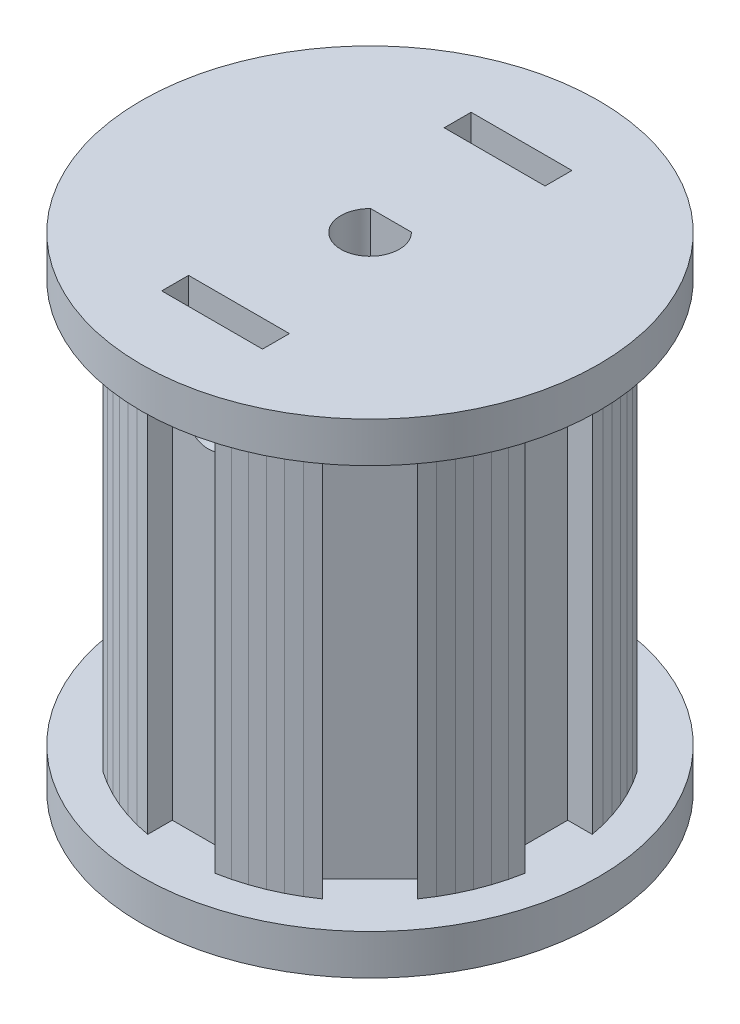
from build123d import *

# Parameters (mm, degrees)
SKETCH1_R           = 17
BOSS_EXTRUDE1_DEPTH = 3
SKETCH3_R           = 17
BOSS_EXTRUDE2_DEPTH = 3
BOSS_EXTRUDE3_DEPTH = 31
SKETCH7_R           = 1.751351815
CUT_EXTRUDE11_DEPTH = 50
CUT_EXTRUDE1_DEPTH  = 50
SKETCH8_W           = 7.5
SKETCH8_H           = 2
CUT_EXTRUDE12_DEPTH = 40


with BuildPart() as part:
    # Sketch1 → Boss-Extrude1 (new body)
    with BuildSketch(Plane(origin=(0, -15, 0), x_dir=(1, 0, 0), z_dir=(0, 1, 0))):
        Circle(SKETCH1_R)
    extrude(amount=BOSS_EXTRUDE1_DEPTH)



with BuildPart() as body_2:
    # Sketch3 → Boss-Extrude2 (new body)
    with BuildSketch(Plane(origin=(0, 21, 0), x_dir=(1, 0, 0), z_dir=(0, 1, 0))):
        Circle(SKETCH3_R)
    extrude(amount=-BOSS_EXTRUDE2_DEPTH)


with BuildPart() as part_1:
    add(part.part)

    add(body_2.part)  # Boss-Extrude3 merges body 2
    # Sketch6 → Boss-Extrude3 (add)
    with BuildSketch(Plane(origin=(0, -12, 0), x_dir=(1, 0, 0), z_dir=(0, 1, 0))):
        Polygon((-10.39609313, -6.860559341), (-11.68775931, -8.152225055), (-12.244775891, -7.288892753), (-12.738139369, -6.387668662), (-13.165283017, -5.453239195), (-13.523988426, -4.490460269), (-13.812389225, -3.504338907), (-14.028987847, -2.499999944), (-12.202296406, -2.499999944), (-12.202296406, 2.499999944), (-14.028987847, 2.499999944), (-13.812389225, 3.504338907), (-13.523988426, 4.490460269), (-13.165283017, 5.453239195), (-12.738139369, 6.387668662), (-12.244775891, 7.288892753), (-11.68775931, 8.152225055), (-10.39609313, 6.860559341), (-6.860559341, 10.39609313), (-8.152225055, 11.68775931), (-7.288892753, 12.244775891), (-6.387668662, 12.738139369), (-5.453239195, 13.165283017), (-4.490460269, 13.523988426), (-3.504338907, 13.812389225), (-2.499999944, 14.028987847), (-2.499999944, 12.174172863), (2.499999944, 12.202296406), (2.499999944, 14.028987847), (3.504338907, 13.812389225), (4.490460269, 13.523988426), (5.453239195, 13.165283017), (6.387668662, 12.738139369), (7.288892753, 12.244775891), (8.152225055, 11.68775931), (6.860559341, 10.39609313), (10.39609313, 6.860559341), (11.68775931, 8.152225055), (12.244775891, 7.288892753), (12.738139369, 6.387668662), (13.165283017, 5.453239195), (13.523988426, 4.490460269), (13.812389225, 3.504338907), (14.028987847, 2.499999944), (12.202296406, 2.499999944), (12.202296406, -2.499999944), (14.028987847, -2.499999944), (13.812389225, -3.504338907), (13.523988426, -4.490460269), (13.165283017, -5.453239195), (12.738139369, -6.387668662), (12.244775891, -7.288892753), (11.68775931, -8.152225055), (10.39609313, -6.860559341), (6.860559341, -10.39609313), (8.152225055, -11.68775931), (7.288892753, -12.244775891), (6.387668662, -12.738139369), (5.453239195, -13.165283017), (4.490460269, -13.523988426), (3.504338907, -13.812389225), (2.499999944, -14.028987847), (2.499999944, -12.202296406), (-2.499999944, -12.202296406), (-2.499999944, -14.028987847), (-3.504338907, -13.812389225), (-4.490460269, -13.523988426), (-5.453239195, -13.165283017), (-6.387668662, -12.738139369), (-7.288892753, -12.244775891), (-8.152225055, -11.68775931), (-6.860559341, -10.39609313), align=None)
    extrude(amount=BOSS_EXTRUDE3_DEPTH)

    # Sketch7 → Cut-Extrude11 (cut)
    with BuildSketch(Plane(origin=(-0.068553102, 0, -12.187849043), x_dir=(-0.9999841817006155, 0, 0.005624619858302935), z_dir=(-0.005624619858302935, 0, -0.9999841817006155))):
        with Locations((-0.120761258, 15)):
            Circle(SKETCH7_R)
    extrude(amount=-CUT_EXTRUDE11_DEPTH, mode=Mode.SUBTRACT)

    # Sketch2 → Cut-Extrude1 (cut)
    with BuildSketch(Plane(origin=(0, -15, 0), x_dir=(1, 0, 0), z_dir=(0, 1, 0))):
        with BuildLine():
            Line((1.514793699, 1.566442938), (-1.521232282, 1.566442938))
            ThreePointArc((-1.521232282, 1.566442938), (-0.003219291, -2.164389177), (1.514793699, 1.566442938))
        make_face()
    extrude(amount=CUT_EXTRUDE1_DEPTH, mode=Mode.SUBTRACT)

    # Sketch8 → Cut-Extrude12 (cut)
    with BuildSketch(Plane(origin=(0, -15, 0), x_dir=(1, 0, 0), z_dir=(0, 1, 0))):
        with Locations((-0.237061367, 10.505385433)):
            Rectangle(SKETCH8_W, SKETCH8_H)
    cut_extrude12 = extrude(amount=CUT_EXTRUDE12_DEPTH, mode=Mode.SUBTRACT)

    # Mirror1: Cut-Extrude12 across plane
    add(cut_extrude12.mirror(Plane.XY), mode=Mode.SUBTRACT)


solid = part_1.part
